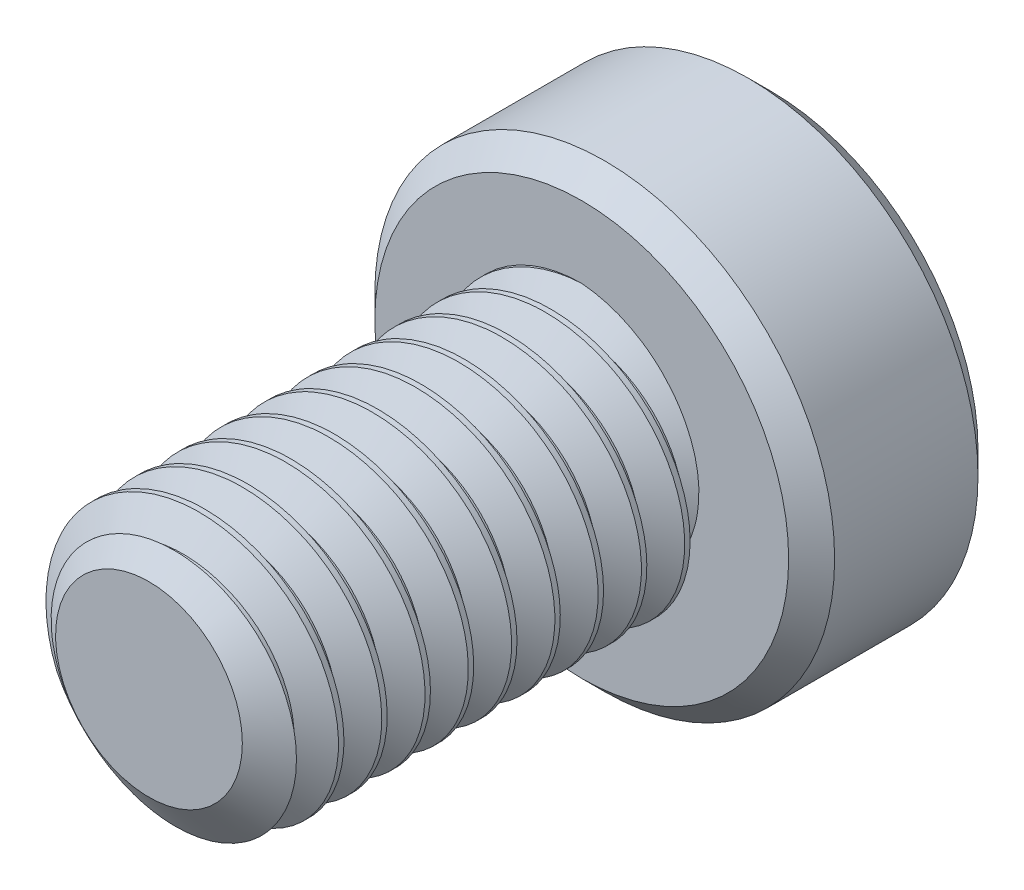
from build123d import *

# Parameters (mm, degrees)
SKETCH1_R          = 2.5
EXTRUDE1_DEPTH     = 8
CUT_SWEEP1_PITCH   = 0.8
SKETCH6_R          = 4.25
EXTRUDE2_DEPTH     = 3.5
CUT_EXTRUDE1_DEPTH = 2.25
CHAMFER1_SIZE      = 0.425


with BuildPart() as part:
    # Sketch1 → Extrude1 (new body)
    with BuildSketch(Plane.XY):
        Circle(SKETCH1_R)
    extrude(amount=-EXTRUDE1_DEPTH)

    # Cut-Sweep1: the profile of Sketch3 profile screwed along a right-hand helix of 11 turns, 6 arcs to a turn; built about Z, then put on its axis
    cut_sweep1_z = Axis((0, 0, 0), (0, 0, 1))
    cut_sweep1_corners = [(2.5003, 0, -0.700173205), (1.980384758, 0, -0.4), (1.980384758, 0, -0.3), (2.5003, 0, 0.000173205)]
    with BuildLine(mode=Mode.PRIVATE) as cut_sweep1_profile:
        Line(cut_sweep1_corners[0], cut_sweep1_corners[1])
        Line(cut_sweep1_corners[1], cut_sweep1_corners[2])
        Line(cut_sweep1_corners[2], cut_sweep1_corners[3])
        Line(cut_sweep1_corners[3], cut_sweep1_corners[0])
    cut_sweep1_cap = Face(cut_sweep1_profile.wire())
    cut_sweep1_turn_angles = [0, 30, 60, 90, 120, 150, 180, 210, 240, 270, 300, 330, 360]
    cut_sweep1_turn_weights = [1, 0.8660254037844387, 1, 0.8660254037844387, 1, 0.8660254037844387, 1, 0.8660254037844387, 1, 0.8660254037844387, 1, 0.8660254037844387, 1]
    cut_sweep1_turn_rails = [Edge.make_bspline([Vector(p[0], p[1], 0).rotate(cut_sweep1_z, cut_sweep1_turn_angles[k]) / cut_sweep1_turn_weights[k] + Vector(0, 0, p[2] + CUT_SWEEP1_PITCH * cut_sweep1_turn_angles[k] / 360) for k in range(13)], [0, 0, 0, 1, 1, 2, 2, 3, 3, 4, 4, 5, 5, 6, 6, 6], 2, cut_sweep1_turn_weights) for p in cut_sweep1_corners]
    cut_sweep1_turn_sides = [Face.make_surface_from_curves(cut_sweep1_turn_rails[p[0]], cut_sweep1_turn_rails[p[1]]) for p in [(0, 1), (1, 2), (2, 3), (3, 0)]]
    cut_sweep1 = Plane(origin=(0, 0, 0), x_dir=(0, 1, 0), z_dir=(0, 0, -1)) * Solid(Shell([*[p.moved(Location((0, 0, CUT_SWEEP1_PITCH * i))) for i in range(11) for p in cut_sweep1_turn_sides], cut_sweep1_cap, cut_sweep1_cap.rotate(cut_sweep1_z, 3960).moved(Location((0, 0, CUT_SWEEP1_PITCH * 3960 / 360)))]))
    add(cut_sweep1, mode=Mode.SUBTRACT)

    # Sketch4 → Cut-Revolve1 (revolve, cut)
    with BuildSketch(Plane(origin=(0, 0, 0), x_dir=(0, 0, -1), z_dir=(1, 0, 0)), mode=Mode.PRIVATE) as cut_revolve1_sk:
        Polygon((0.541691224, 2.5), (0, 1.726384758), (0, 2.5), align=None)
    revolve(cut_revolve1_sk.sketch.rotate(Axis((0, 0, 0), (0, 0, -1)), 260.43858876), axis=Axis((0, 0, 0), (0, 0, -1)), mode=Mode.SUBTRACT)

    # Sketch6 → Extrude2 (add)
    with BuildSketch(Plane(origin=(0, 0, -8), x_dir=(-1, 0, 0), z_dir=(0, 0, -1))):
        Circle(SKETCH6_R)
    extrude(amount=EXTRUDE2_DEPTH)

    # Sketch7 → Cut-Extrude1 (cut)
    with BuildSketch(Plane(origin=(0, 0, -11.5), x_dir=(-1, 0, 0), z_dir=(0, 0, -1))):
        Polygon((0, 1.732050808), (-1.5, 0.866025404), (-1.5, -0.866025404), (0, -1.732050808), (1.5, -0.866025404), (1.5, 0.866025404), align=None)
    extrude(amount=-CUT_EXTRUDE1_DEPTH, mode=Mode.SUBTRACT)

    # Cut-Extrude2 cone 1 section (through the dimple's axis) → Cut-Extrude2 (revolve, cut)
    with BuildSketch(Plane(origin=(0, 0, -11.5), x_dir=(0, 1, 0), z_dir=(1, 0, 0))):
        Polygon((0, 0), (1.732050808, 0), (0, 1.732050808), align=None)
    revolve(axis=Axis((0, 0, -11.5), (0, 0, 1)), mode=Mode.SUBTRACT)

    # Chamfer1
    chamfer1_edges = [part.edges().sort_by_distance(p)[0] for p in [
        (4.25, 0, -8),
        (4.25, 0, -11.5),
    ]]
    chamfer(chamfer1_edges, length=CHAMFER1_SIZE)


solid = part.part
